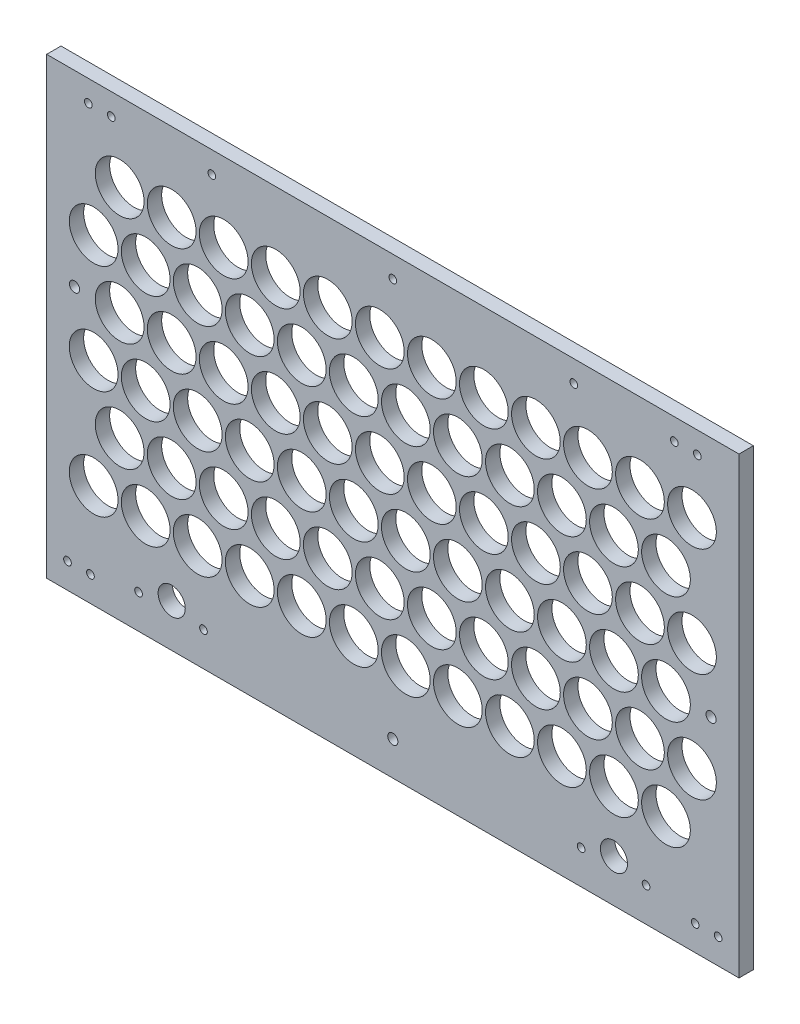
from build123d import *

# Parameters (mm, degrees)
SKETCH1_W                  = 306.05000007
SKETCH1_H                  = 197.4250001
BOSS_EXTRUDE1_DEPTH        = 6.35
CUT_EXTRUDE1_DEPTH         = 187.132543615
SKETCH4_R                  = 10.775
CUT_EXTRUDE2_DEPTH         = 187.132543615
LPATTERN1_COUNT            = 12
LPATTERN1_PITCH            = 23
LPATTERN2_COPY_1_DEPTH     = 187.132543615
LPATTERN2_COPY_2_DEPTH     = 187.132543615
LPATTERN2_COPY_3_DEPTH     = 187.132543615
LPATTERN2_COPY_4_DEPTH     = 187.132543615
LPATTERN2_COPY_5_DEPTH     = 187.132543615
LPATTERN2_COPY_6_DEPTH     = 187.132543615
LPATTERN2_COPY_7_DEPTH     = 187.132543615
LPATTERN2_COPY_8_DEPTH     = 187.132543615
LPATTERN2_COPY_9_DEPTH     = 187.132543615
LPATTERN2_COPY_10_DEPTH    = 187.132543615
LPATTERN2_COPY_11_DEPTH    = 187.132543615
LPATTERN2_COPY_12_DEPTH    = 187.132543615
LPATTERN2_COPY_13_DEPTH    = 187.132543615
LPATTERN2_COPY_14_DEPTH    = 187.132543615
LPATTERN2_COPY_15_DEPTH    = 187.132543615
LPATTERN2_COPY_16_DEPTH    = 187.132543615
LPATTERN2_COPY_17_DEPTH    = 187.132543615
LPATTERN2_COPY_18_DEPTH    = 187.132543615
LPATTERN2_COPY_19_DEPTH    = 187.132543615
LPATTERN2_COPY_20_DEPTH    = 187.132543615
LPATTERN2_COPY_21_DEPTH    = 187.132543615
LPATTERN2_COPY_22_DEPTH    = 187.132543615
LPATTERN2_COPY_23_SKETCH_R = 10.775
LPATTERN2_COPY_23_DEPTH    = 187.132543615
LPATTERN2_COPY_24_SKETCH_R = 10.775
LPATTERN2_COPY_24_DEPTH    = 187.132543615
LPATTERN2_COPY_25_SKETCH_R = 10.775
LPATTERN2_COPY_25_DEPTH    = 187.132543615
LPATTERN2_COPY_26_SKETCH_R = 10.775
LPATTERN2_COPY_26_DEPTH    = 187.132543615
LPATTERN2_COPY_27_SKETCH_R = 10.775
LPATTERN2_COPY_27_DEPTH    = 187.132543615
LPATTERN2_COPY_28_SKETCH_R = 10.775
LPATTERN2_COPY_28_DEPTH    = 187.132543615
LPATTERN2_COPY_29_SKETCH_R = 10.775
LPATTERN2_COPY_29_DEPTH    = 187.132543615
LPATTERN2_COPY_30_SKETCH_R = 10.775
LPATTERN2_COPY_30_DEPTH    = 187.132543615
LPATTERN2_COPY_31_SKETCH_R = 10.775
LPATTERN2_COPY_31_DEPTH    = 187.132543615
LPATTERN2_COPY_32_SKETCH_R = 10.775
LPATTERN2_COPY_32_DEPTH    = 187.132543615
LPATTERN2_COPY_33_SKETCH_R = 10.775
LPATTERN2_COPY_33_DEPTH    = 187.132543615
LPATTERN2_COPY_34_SKETCH_R = 10.775
LPATTERN2_COPY_34_DEPTH    = 187.132543615
LPATTERN2_COPY_35_SKETCH_R = 10.775
LPATTERN2_COPY_35_DEPTH    = 187.132543615
LPATTERN2_COPY_36_SKETCH_R = 10.775
LPATTERN2_COPY_36_DEPTH    = 187.132543615
LPATTERN2_COPY_37_SKETCH_R = 10.775
LPATTERN2_COPY_37_DEPTH    = 187.132543615
LPATTERN2_COPY_38_SKETCH_R = 10.775
LPATTERN2_COPY_38_DEPTH    = 187.132543615
LPATTERN2_COPY_39_SKETCH_R = 10.775
LPATTERN2_COPY_39_DEPTH    = 187.132543615
LPATTERN2_COPY_40_SKETCH_R = 10.775
LPATTERN2_COPY_40_DEPTH    = 187.132543615
LPATTERN2_COPY_41_SKETCH_R = 10.775
LPATTERN2_COPY_41_DEPTH    = 187.132543615
LPATTERN2_COPY_42_SKETCH_R = 10.775
LPATTERN2_COPY_42_DEPTH    = 187.132543615
LPATTERN2_COPY_43_SKETCH_R = 10.775
LPATTERN2_COPY_43_DEPTH    = 187.132543615
LPATTERN2_COPY_44_SKETCH_R = 10.775
LPATTERN2_COPY_44_DEPTH    = 187.132543615
LPATTERN2_COPY_45_DEPTH    = 187.132543615
LPATTERN2_COPY_46_DEPTH    = 187.132543615
LPATTERN2_COPY_47_SKETCH_R = 10.775
LPATTERN2_COPY_47_DEPTH    = 187.132543615
LPATTERN2_COPY_48_SKETCH_R = 10.775
LPATTERN2_COPY_48_DEPTH    = 187.132543615
SKETCH13_W                 = 306.05000007
SKETCH13_H                 = 6.35
BOSS_EXTRUDE2_DEPTH        = 3.175
SKETCH14_R                 = 6
CUT_EXTRUDE3_DEPTH         = 187.132543615
M3_CLEARANCE_HOLE1_D       = 3.4
SKETCH17_R                 = 2.25
CUT_EXTRUDE4_DEPTH         = 187.132543615


with BuildPart() as part:
    # Sketch1 → Boss-Extrude1 (new body)
    with BuildSketch(Plane.XY):
        with Locations((3.5e-08, -7.06250005)):
            Rectangle(SKETCH1_W, SKETCH1_H)
    extrude(amount=BOSS_EXTRUDE1_DEPTH)

    # Sketch3 → Cut-Extrude1 (cut, through all)
    with BuildSketch(Plane.XY.offset(6.35)):
        with BuildLine():
            ThreePointArc((-121.475, -60), (-132.24999993, -49.225), (-143.025, -59.999999859))
            ThreePointArc((-143.025, -59.999999859), (-139.869075617, -67.619075517), (-132.25, -70.775))
            ThreePointArc((-132.25, -70.775), (-124.630924433, -67.619075567), (-121.475, -60))
        make_face()
    cut_extrude1 = extrude(amount=-CUT_EXTRUDE1_DEPTH, mode=Mode.SUBTRACT)

    # Sketch4 → Cut-Extrude2 (cut, through all)
    with BuildSketch(Plane.XY.offset(6.35)):
        with Locations((-120.75, -36)):
            Circle(SKETCH4_R)
    cut_extrude2 = extrude(amount=-CUT_EXTRUDE2_DEPTH, mode=Mode.SUBTRACT)

    # LPattern1: Cut-Extrude1, Cut-Extrude2 ×12
    with Locations(*[(i * LPATTERN1_PITCH, 0, 0) for i in range(1, LPATTERN1_COUNT)]):
        add(cut_extrude1, mode=Mode.SUBTRACT)
        add(cut_extrude2, mode=Mode.SUBTRACT)

    # LPattern2 copy 1 sketch → LPattern2 copy 1 (cut, through all)
    with BuildSketch(Plane(origin=(23, 48, 6.35), x_dir=(1, 0, 0), z_dir=(0, 0, 1))):
        with BuildLine():
            ThreePointArc((-121.475, -60), (-132.24999993, -49.225), (-143.025, -59.999999859))
            ThreePointArc((-143.025, -59.999999859), (-139.869075617, -67.619075517), (-132.25, -70.775))
            ThreePointArc((-132.25, -70.775), (-124.630924433, -67.619075567), (-121.475, -60))
        make_face()
    extrude(amount=-LPATTERN2_COPY_1_DEPTH, mode=Mode.SUBTRACT)

    # LPattern2 copy 2 sketch → LPattern2 copy 2 (cut, through all)
    with BuildSketch(Plane(origin=(23, 96, 6.35), x_dir=(1, 0, 0), z_dir=(0, 0, 1))):
        with BuildLine():
            ThreePointArc((-121.475, -60), (-132.24999993, -49.225), (-143.025, -59.999999859))
            ThreePointArc((-143.025, -59.999999859), (-139.869075617, -67.619075517), (-132.25, -70.775))
            ThreePointArc((-132.25, -70.775), (-124.630924433, -67.619075567), (-121.475, -60))
        make_face()
    extrude(amount=-LPATTERN2_COPY_2_DEPTH, mode=Mode.SUBTRACT)

    # LPattern2 copy 3 sketch → LPattern2 copy 3 (cut, through all)
    with BuildSketch(Plane(origin=(46, 48, 6.35), x_dir=(1, 0, 0), z_dir=(0, 0, 1))):
        with BuildLine():
            ThreePointArc((-121.475, -60), (-132.24999993, -49.225), (-143.025, -59.999999859))
            ThreePointArc((-143.025, -59.999999859), (-139.869075617, -67.619075517), (-132.25, -70.775))
            ThreePointArc((-132.25, -70.775), (-124.630924433, -67.619075567), (-121.475, -60))
        make_face()
    extrude(amount=-LPATTERN2_COPY_3_DEPTH, mode=Mode.SUBTRACT)

    # LPattern2 copy 4 sketch → LPattern2 copy 4 (cut, through all)
    with BuildSketch(Plane(origin=(46, 96, 6.35), x_dir=(1, 0, 0), z_dir=(0, 0, 1))):
        with BuildLine():
            ThreePointArc((-121.475, -60), (-132.24999993, -49.225), (-143.025, -59.999999859))
            ThreePointArc((-143.025, -59.999999859), (-139.869075617, -67.619075517), (-132.25, -70.775))
            ThreePointArc((-132.25, -70.775), (-124.630924433, -67.619075567), (-121.475, -60))
        make_face()
    extrude(amount=-LPATTERN2_COPY_4_DEPTH, mode=Mode.SUBTRACT)

    # LPattern2 copy 5 sketch → LPattern2 copy 5 (cut, through all)
    with BuildSketch(Plane(origin=(69, 48, 6.35), x_dir=(1, 0, 0), z_dir=(0, 0, 1))):
        with BuildLine():
            ThreePointArc((-121.475, -60), (-132.24999993, -49.225), (-143.025, -59.999999859))
            ThreePointArc((-143.025, -59.999999859), (-139.869075617, -67.619075517), (-132.25, -70.775))
            ThreePointArc((-132.25, -70.775), (-124.630924433, -67.619075567), (-121.475, -60))
        make_face()
    extrude(amount=-LPATTERN2_COPY_5_DEPTH, mode=Mode.SUBTRACT)

    # LPattern2 copy 6 sketch → LPattern2 copy 6 (cut, through all)
    with BuildSketch(Plane(origin=(69, 96, 6.35), x_dir=(1, 0, 0), z_dir=(0, 0, 1))):
        with BuildLine():
            ThreePointArc((-121.475, -60), (-132.24999993, -49.225), (-143.025, -59.999999859))
            ThreePointArc((-143.025, -59.999999859), (-139.869075617, -67.619075517), (-132.25, -70.775))
            ThreePointArc((-132.25, -70.775), (-124.630924433, -67.619075567), (-121.475, -60))
        make_face()
    extrude(amount=-LPATTERN2_COPY_6_DEPTH, mode=Mode.SUBTRACT)

    # LPattern2 copy 7 sketch → LPattern2 copy 7 (cut, through all)
    with BuildSketch(Plane(origin=(92, 48, 6.35), x_dir=(1, 0, 0), z_dir=(0, 0, 1))):
        with BuildLine():
            ThreePointArc((-121.475, -60), (-132.24999993, -49.225), (-143.025, -59.999999859))
            ThreePointArc((-143.025, -59.999999859), (-139.869075617, -67.619075517), (-132.25, -70.775))
            ThreePointArc((-132.25, -70.775), (-124.630924433, -67.619075567), (-121.475, -60))
        make_face()
    extrude(amount=-LPATTERN2_COPY_7_DEPTH, mode=Mode.SUBTRACT)

    # LPattern2 copy 8 sketch → LPattern2 copy 8 (cut, through all)
    with BuildSketch(Plane(origin=(92, 96, 6.35), x_dir=(1, 0, 0), z_dir=(0, 0, 1))):
        with BuildLine():
            ThreePointArc((-121.475, -60), (-132.24999993, -49.225), (-143.025, -59.999999859))
            ThreePointArc((-143.025, -59.999999859), (-139.869075617, -67.619075517), (-132.25, -70.775))
            ThreePointArc((-132.25, -70.775), (-124.630924433, -67.619075567), (-121.475, -60))
        make_face()
    extrude(amount=-LPATTERN2_COPY_8_DEPTH, mode=Mode.SUBTRACT)

    # LPattern2 copy 9 sketch → LPattern2 copy 9 (cut, through all)
    with BuildSketch(Plane(origin=(115, 48, 6.35), x_dir=(1, 0, 0), z_dir=(0, 0, 1))):
        with BuildLine():
            ThreePointArc((-121.475, -60), (-132.24999993, -49.225), (-143.025, -59.999999859))
            ThreePointArc((-143.025, -59.999999859), (-139.869075617, -67.619075517), (-132.25, -70.775))
            ThreePointArc((-132.25, -70.775), (-124.630924433, -67.619075567), (-121.475, -60))
        make_face()
    extrude(amount=-LPATTERN2_COPY_9_DEPTH, mode=Mode.SUBTRACT)

    # LPattern2 copy 10 sketch → LPattern2 copy 10 (cut, through all)
    with BuildSketch(Plane(origin=(115, 96, 6.35), x_dir=(1, 0, 0), z_dir=(0, 0, 1))):
        with BuildLine():
            ThreePointArc((-121.475, -60), (-132.24999993, -49.225), (-143.025, -59.999999859))
            ThreePointArc((-143.025, -59.999999859), (-139.869075617, -67.619075517), (-132.25, -70.775))
            ThreePointArc((-132.25, -70.775), (-124.630924433, -67.619075567), (-121.475, -60))
        make_face()
    extrude(amount=-LPATTERN2_COPY_10_DEPTH, mode=Mode.SUBTRACT)

    # LPattern2 copy 11 sketch → LPattern2 copy 11 (cut, through all)
    with BuildSketch(Plane(origin=(138, 48, 6.35), x_dir=(1, 0, 0), z_dir=(0, 0, 1))):
        with BuildLine():
            ThreePointArc((-121.475, -60), (-132.24999993, -49.225), (-143.025, -59.999999859))
            ThreePointArc((-143.025, -59.999999859), (-139.869075617, -67.619075517), (-132.25, -70.775))
            ThreePointArc((-132.25, -70.775), (-124.630924433, -67.619075567), (-121.475, -60))
        make_face()
    extrude(amount=-LPATTERN2_COPY_11_DEPTH, mode=Mode.SUBTRACT)

    # LPattern2 copy 12 sketch → LPattern2 copy 12 (cut, through all)
    with BuildSketch(Plane(origin=(138, 96, 6.35), x_dir=(1, 0, 0), z_dir=(0, 0, 1))):
        with BuildLine():
            ThreePointArc((-121.475, -60), (-132.24999993, -49.225), (-143.025, -59.999999859))
            ThreePointArc((-143.025, -59.999999859), (-139.869075617, -67.619075517), (-132.25, -70.775))
            ThreePointArc((-132.25, -70.775), (-124.630924433, -67.619075567), (-121.475, -60))
        make_face()
    extrude(amount=-LPATTERN2_COPY_12_DEPTH, mode=Mode.SUBTRACT)

    # LPattern2 copy 13 sketch → LPattern2 copy 13 (cut, through all)
    with BuildSketch(Plane(origin=(161, 48, 6.35), x_dir=(1, 0, 0), z_dir=(0, 0, 1))):
        with BuildLine():
            ThreePointArc((-121.475, -60), (-132.24999993, -49.225), (-143.025, -59.999999859))
            ThreePointArc((-143.025, -59.999999859), (-139.869075617, -67.619075517), (-132.25, -70.775))
            ThreePointArc((-132.25, -70.775), (-124.630924433, -67.619075567), (-121.475, -60))
        make_face()
    extrude(amount=-LPATTERN2_COPY_13_DEPTH, mode=Mode.SUBTRACT)

    # LPattern2 copy 14 sketch → LPattern2 copy 14 (cut, through all)
    with BuildSketch(Plane(origin=(161, 96, 6.35), x_dir=(1, 0, 0), z_dir=(0, 0, 1))):
        with BuildLine():
            ThreePointArc((-121.475, -60), (-132.24999993, -49.225), (-143.025, -59.999999859))
            ThreePointArc((-143.025, -59.999999859), (-139.869075617, -67.619075517), (-132.25, -70.775))
            ThreePointArc((-132.25, -70.775), (-124.630924433, -67.619075567), (-121.475, -60))
        make_face()
    extrude(amount=-LPATTERN2_COPY_14_DEPTH, mode=Mode.SUBTRACT)

    # LPattern2 copy 15 sketch → LPattern2 copy 15 (cut, through all)
    with BuildSketch(Plane(origin=(184, 48, 6.35), x_dir=(1, 0, 0), z_dir=(0, 0, 1))):
        with BuildLine():
            ThreePointArc((-121.475, -60), (-132.24999993, -49.225), (-143.025, -59.999999859))
            ThreePointArc((-143.025, -59.999999859), (-139.869075617, -67.619075517), (-132.25, -70.775))
            ThreePointArc((-132.25, -70.775), (-124.630924433, -67.619075567), (-121.475, -60))
        make_face()
    extrude(amount=-LPATTERN2_COPY_15_DEPTH, mode=Mode.SUBTRACT)

    # LPattern2 copy 16 sketch → LPattern2 copy 16 (cut, through all)
    with BuildSketch(Plane(origin=(184, 96, 6.35), x_dir=(1, 0, 0), z_dir=(0, 0, 1))):
        with BuildLine():
            ThreePointArc((-121.475, -60), (-132.24999993, -49.225), (-143.025, -59.999999859))
            ThreePointArc((-143.025, -59.999999859), (-139.869075617, -67.619075517), (-132.25, -70.775))
            ThreePointArc((-132.25, -70.775), (-124.630924433, -67.619075567), (-121.475, -60))
        make_face()
    extrude(amount=-LPATTERN2_COPY_16_DEPTH, mode=Mode.SUBTRACT)

    # LPattern2 copy 17 sketch → LPattern2 copy 17 (cut, through all)
    with BuildSketch(Plane(origin=(207, 48, 6.35), x_dir=(1, 0, 0), z_dir=(0, 0, 1))):
        with BuildLine():
            ThreePointArc((-121.475, -60), (-132.24999993, -49.225), (-143.025, -59.999999859))
            ThreePointArc((-143.025, -59.999999859), (-139.869075617, -67.619075517), (-132.25, -70.775))
            ThreePointArc((-132.25, -70.775), (-124.630924433, -67.619075567), (-121.475, -60))
        make_face()
    extrude(amount=-LPATTERN2_COPY_17_DEPTH, mode=Mode.SUBTRACT)

    # LPattern2 copy 18 sketch → LPattern2 copy 18 (cut, through all)
    with BuildSketch(Plane(origin=(207, 96, 6.35), x_dir=(1, 0, 0), z_dir=(0, 0, 1))):
        with BuildLine():
            ThreePointArc((-121.475, -60), (-132.24999993, -49.225), (-143.025, -59.999999859))
            ThreePointArc((-143.025, -59.999999859), (-139.869075617, -67.619075517), (-132.25, -70.775))
            ThreePointArc((-132.25, -70.775), (-124.630924433, -67.619075567), (-121.475, -60))
        make_face()
    extrude(amount=-LPATTERN2_COPY_18_DEPTH, mode=Mode.SUBTRACT)

    # LPattern2 copy 19 sketch → LPattern2 copy 19 (cut, through all)
    with BuildSketch(Plane(origin=(230, 48, 6.35), x_dir=(1, 0, 0), z_dir=(0, 0, 1))):
        with BuildLine():
            ThreePointArc((-121.475, -60), (-132.24999993, -49.225), (-143.025, -59.999999859))
            ThreePointArc((-143.025, -59.999999859), (-139.869075617, -67.619075517), (-132.25, -70.775))
            ThreePointArc((-132.25, -70.775), (-124.630924433, -67.619075567), (-121.475, -60))
        make_face()
    extrude(amount=-LPATTERN2_COPY_19_DEPTH, mode=Mode.SUBTRACT)

    # LPattern2 copy 20 sketch → LPattern2 copy 20 (cut, through all)
    with BuildSketch(Plane(origin=(230, 96, 6.35), x_dir=(1, 0, 0), z_dir=(0, 0, 1))):
        with BuildLine():
            ThreePointArc((-121.475, -60), (-132.24999993, -49.225), (-143.025, -59.999999859))
            ThreePointArc((-143.025, -59.999999859), (-139.869075617, -67.619075517), (-132.25, -70.775))
            ThreePointArc((-132.25, -70.775), (-124.630924433, -67.619075567), (-121.475, -60))
        make_face()
    extrude(amount=-LPATTERN2_COPY_20_DEPTH, mode=Mode.SUBTRACT)

    # LPattern2 copy 21 sketch → LPattern2 copy 21 (cut, through all)
    with BuildSketch(Plane(origin=(253, 48, 6.35), x_dir=(1, 0, 0), z_dir=(0, 0, 1))):
        with BuildLine():
            ThreePointArc((-121.475, -60), (-132.24999993, -49.225), (-143.025, -59.999999859))
            ThreePointArc((-143.025, -59.999999859), (-139.869075617, -67.619075517), (-132.25, -70.775))
            ThreePointArc((-132.25, -70.775), (-124.630924433, -67.619075567), (-121.475, -60))
        make_face()
    extrude(amount=-LPATTERN2_COPY_21_DEPTH, mode=Mode.SUBTRACT)

    # LPattern2 copy 22 sketch → LPattern2 copy 22 (cut, through all)
    with BuildSketch(Plane(origin=(253, 96, 6.35), x_dir=(1, 0, 0), z_dir=(0, 0, 1))):
        with BuildLine():
            ThreePointArc((-121.475, -60), (-132.24999993, -49.225), (-143.025, -59.999999859))
            ThreePointArc((-143.025, -59.999999859), (-139.869075617, -67.619075517), (-132.25, -70.775))
            ThreePointArc((-132.25, -70.775), (-124.630924433, -67.619075567), (-121.475, -60))
        make_face()
    extrude(amount=-LPATTERN2_COPY_22_DEPTH, mode=Mode.SUBTRACT)

    # LPattern2 copy 23 sketch → LPattern2 copy 23 (cut, through all)
    with BuildSketch(Plane(origin=(23, 48, 6.35), x_dir=(1, 0, 0), z_dir=(0, 0, 1))):
        with Locations((-120.75, -36)):
            Circle(LPATTERN2_COPY_23_SKETCH_R)
    extrude(amount=-LPATTERN2_COPY_23_DEPTH, mode=Mode.SUBTRACT)

    # LPattern2 copy 24 sketch → LPattern2 copy 24 (cut, through all)
    with BuildSketch(Plane(origin=(23, 96, 6.35), x_dir=(1, 0, 0), z_dir=(0, 0, 1))):
        with Locations((-120.75, -36)):
            Circle(LPATTERN2_COPY_24_SKETCH_R)
    extrude(amount=-LPATTERN2_COPY_24_DEPTH, mode=Mode.SUBTRACT)

    # LPattern2 copy 25 sketch → LPattern2 copy 25 (cut, through all)
    with BuildSketch(Plane(origin=(46, 48, 6.35), x_dir=(1, 0, 0), z_dir=(0, 0, 1))):
        with Locations((-120.75, -36)):
            Circle(LPATTERN2_COPY_25_SKETCH_R)
    extrude(amount=-LPATTERN2_COPY_25_DEPTH, mode=Mode.SUBTRACT)

    # LPattern2 copy 26 sketch → LPattern2 copy 26 (cut, through all)
    with BuildSketch(Plane(origin=(46, 96, 6.35), x_dir=(1, 0, 0), z_dir=(0, 0, 1))):
        with Locations((-120.75, -36)):
            Circle(LPATTERN2_COPY_26_SKETCH_R)
    extrude(amount=-LPATTERN2_COPY_26_DEPTH, mode=Mode.SUBTRACT)

    # LPattern2 copy 27 sketch → LPattern2 copy 27 (cut, through all)
    with BuildSketch(Plane(origin=(69, 48, 6.35), x_dir=(1, 0, 0), z_dir=(0, 0, 1))):
        with Locations((-120.75, -36)):
            Circle(LPATTERN2_COPY_27_SKETCH_R)
    extrude(amount=-LPATTERN2_COPY_27_DEPTH, mode=Mode.SUBTRACT)

    # LPattern2 copy 28 sketch → LPattern2 copy 28 (cut, through all)
    with BuildSketch(Plane(origin=(69, 96, 6.35), x_dir=(1, 0, 0), z_dir=(0, 0, 1))):
        with Locations((-120.75, -36)):
            Circle(LPATTERN2_COPY_28_SKETCH_R)
    extrude(amount=-LPATTERN2_COPY_28_DEPTH, mode=Mode.SUBTRACT)

    # LPattern2 copy 29 sketch → LPattern2 copy 29 (cut, through all)
    with BuildSketch(Plane(origin=(92, 48, 6.35), x_dir=(1, 0, 0), z_dir=(0, 0, 1))):
        with Locations((-120.75, -36)):
            Circle(LPATTERN2_COPY_29_SKETCH_R)
    extrude(amount=-LPATTERN2_COPY_29_DEPTH, mode=Mode.SUBTRACT)

    # LPattern2 copy 30 sketch → LPattern2 copy 30 (cut, through all)
    with BuildSketch(Plane(origin=(92, 96, 6.35), x_dir=(1, 0, 0), z_dir=(0, 0, 1))):
        with Locations((-120.75, -36)):
            Circle(LPATTERN2_COPY_30_SKETCH_R)
    extrude(amount=-LPATTERN2_COPY_30_DEPTH, mode=Mode.SUBTRACT)

    # LPattern2 copy 31 sketch → LPattern2 copy 31 (cut, through all)
    with BuildSketch(Plane(origin=(115, 48, 6.35), x_dir=(1, 0, 0), z_dir=(0, 0, 1))):
        with Locations((-120.75, -36)):
            Circle(LPATTERN2_COPY_31_SKETCH_R)
    extrude(amount=-LPATTERN2_COPY_31_DEPTH, mode=Mode.SUBTRACT)

    # LPattern2 copy 32 sketch → LPattern2 copy 32 (cut, through all)
    with BuildSketch(Plane(origin=(115, 96, 6.35), x_dir=(1, 0, 0), z_dir=(0, 0, 1))):
        with Locations((-120.75, -36)):
            Circle(LPATTERN2_COPY_32_SKETCH_R)
    extrude(amount=-LPATTERN2_COPY_32_DEPTH, mode=Mode.SUBTRACT)

    # LPattern2 copy 33 sketch → LPattern2 copy 33 (cut, through all)
    with BuildSketch(Plane(origin=(138, 48, 6.35), x_dir=(1, 0, 0), z_dir=(0, 0, 1))):
        with Locations((-120.75, -36)):
            Circle(LPATTERN2_COPY_33_SKETCH_R)
    extrude(amount=-LPATTERN2_COPY_33_DEPTH, mode=Mode.SUBTRACT)

    # LPattern2 copy 34 sketch → LPattern2 copy 34 (cut, through all)
    with BuildSketch(Plane(origin=(138, 96, 6.35), x_dir=(1, 0, 0), z_dir=(0, 0, 1))):
        with Locations((-120.75, -36)):
            Circle(LPATTERN2_COPY_34_SKETCH_R)
    extrude(amount=-LPATTERN2_COPY_34_DEPTH, mode=Mode.SUBTRACT)

    # LPattern2 copy 35 sketch → LPattern2 copy 35 (cut, through all)
    with BuildSketch(Plane(origin=(161, 48, 6.35), x_dir=(1, 0, 0), z_dir=(0, 0, 1))):
        with Locations((-120.75, -36)):
            Circle(LPATTERN2_COPY_35_SKETCH_R)
    extrude(amount=-LPATTERN2_COPY_35_DEPTH, mode=Mode.SUBTRACT)

    # LPattern2 copy 36 sketch → LPattern2 copy 36 (cut, through all)
    with BuildSketch(Plane(origin=(161, 96, 6.35), x_dir=(1, 0, 0), z_dir=(0, 0, 1))):
        with Locations((-120.75, -36)):
            Circle(LPATTERN2_COPY_36_SKETCH_R)
    extrude(amount=-LPATTERN2_COPY_36_DEPTH, mode=Mode.SUBTRACT)

    # LPattern2 copy 37 sketch → LPattern2 copy 37 (cut, through all)
    with BuildSketch(Plane(origin=(184, 48, 6.35), x_dir=(1, 0, 0), z_dir=(0, 0, 1))):
        with Locations((-120.75, -36)):
            Circle(LPATTERN2_COPY_37_SKETCH_R)
    extrude(amount=-LPATTERN2_COPY_37_DEPTH, mode=Mode.SUBTRACT)

    # LPattern2 copy 38 sketch → LPattern2 copy 38 (cut, through all)
    with BuildSketch(Plane(origin=(184, 96, 6.35), x_dir=(1, 0, 0), z_dir=(0, 0, 1))):
        with Locations((-120.75, -36)):
            Circle(LPATTERN2_COPY_38_SKETCH_R)
    extrude(amount=-LPATTERN2_COPY_38_DEPTH, mode=Mode.SUBTRACT)

    # LPattern2 copy 39 sketch → LPattern2 copy 39 (cut, through all)
    with BuildSketch(Plane(origin=(207, 48, 6.35), x_dir=(1, 0, 0), z_dir=(0, 0, 1))):
        with Locations((-120.75, -36)):
            Circle(LPATTERN2_COPY_39_SKETCH_R)
    extrude(amount=-LPATTERN2_COPY_39_DEPTH, mode=Mode.SUBTRACT)

    # LPattern2 copy 40 sketch → LPattern2 copy 40 (cut, through all)
    with BuildSketch(Plane(origin=(207, 96, 6.35), x_dir=(1, 0, 0), z_dir=(0, 0, 1))):
        with Locations((-120.75, -36)):
            Circle(LPATTERN2_COPY_40_SKETCH_R)
    extrude(amount=-LPATTERN2_COPY_40_DEPTH, mode=Mode.SUBTRACT)

    # LPattern2 copy 41 sketch → LPattern2 copy 41 (cut, through all)
    with BuildSketch(Plane(origin=(230, 48, 6.35), x_dir=(1, 0, 0), z_dir=(0, 0, 1))):
        with Locations((-120.75, -36)):
            Circle(LPATTERN2_COPY_41_SKETCH_R)
    extrude(amount=-LPATTERN2_COPY_41_DEPTH, mode=Mode.SUBTRACT)

    # LPattern2 copy 42 sketch → LPattern2 copy 42 (cut, through all)
    with BuildSketch(Plane(origin=(230, 96, 6.35), x_dir=(1, 0, 0), z_dir=(0, 0, 1))):
        with Locations((-120.75, -36)):
            Circle(LPATTERN2_COPY_42_SKETCH_R)
    extrude(amount=-LPATTERN2_COPY_42_DEPTH, mode=Mode.SUBTRACT)

    # LPattern2 copy 43 sketch → LPattern2 copy 43 (cut, through all)
    with BuildSketch(Plane(origin=(253, 48, 6.35), x_dir=(1, 0, 0), z_dir=(0, 0, 1))):
        with Locations((-120.75, -36)):
            Circle(LPATTERN2_COPY_43_SKETCH_R)
    extrude(amount=-LPATTERN2_COPY_43_DEPTH, mode=Mode.SUBTRACT)

    # LPattern2 copy 44 sketch → LPattern2 copy 44 (cut, through all)
    with BuildSketch(Plane(origin=(253, 96, 6.35), x_dir=(1, 0, 0), z_dir=(0, 0, 1))):
        with Locations((-120.75, -36)):
            Circle(LPATTERN2_COPY_44_SKETCH_R)
    extrude(amount=-LPATTERN2_COPY_44_DEPTH, mode=Mode.SUBTRACT)

    # LPattern2 copy 45 sketch → LPattern2 copy 45 (cut, through all)
    with BuildSketch(Plane(origin=(0, 48, 6.35), x_dir=(1, 0, 0), z_dir=(0, 0, 1))):
        with BuildLine():
            ThreePointArc((-121.475, -60), (-132.24999993, -49.225), (-143.025, -59.999999859))
            ThreePointArc((-143.025, -59.999999859), (-139.869075617, -67.619075517), (-132.25, -70.775))
            ThreePointArc((-132.25, -70.775), (-124.630924433, -67.619075567), (-121.475, -60))
        make_face()
    extrude(amount=-LPATTERN2_COPY_45_DEPTH, mode=Mode.SUBTRACT)

    # LPattern2 copy 46 sketch → LPattern2 copy 46 (cut, through all)
    with BuildSketch(Plane(origin=(0, 96, 6.35), x_dir=(1, 0, 0), z_dir=(0, 0, 1))):
        with BuildLine():
            ThreePointArc((-121.475, -60), (-132.24999993, -49.225), (-143.025, -59.999999859))
            ThreePointArc((-143.025, -59.999999859), (-139.869075617, -67.619075517), (-132.25, -70.775))
            ThreePointArc((-132.25, -70.775), (-124.630924433, -67.619075567), (-121.475, -60))
        make_face()
    extrude(amount=-LPATTERN2_COPY_46_DEPTH, mode=Mode.SUBTRACT)

    # LPattern2 copy 47 sketch → LPattern2 copy 47 (cut, through all)
    with BuildSketch(Plane(origin=(0, 48, 6.35), x_dir=(1, 0, 0), z_dir=(0, 0, 1))):
        with Locations((-120.75, -36)):
            Circle(LPATTERN2_COPY_47_SKETCH_R)
    extrude(amount=-LPATTERN2_COPY_47_DEPTH, mode=Mode.SUBTRACT)

    # LPattern2 copy 48 sketch → LPattern2 copy 48 (cut, through all)
    with BuildSketch(Plane(origin=(0, 96, 6.35), x_dir=(1, 0, 0), z_dir=(0, 0, 1))):
        with Locations((-120.75, -36)):
            Circle(LPATTERN2_COPY_48_SKETCH_R)
    extrude(amount=-LPATTERN2_COPY_48_DEPTH, mode=Mode.SUBTRACT)

    # Sketch13 → Boss-Extrude2 (add)
    with BuildSketch(Plane(origin=(0, 91.65, 0), x_dir=(1, 0, 0), z_dir=(0, 1, 0))):
        with Locations((3.5e-08, -3.175)):
            Rectangle(SKETCH13_W, SKETCH13_H)
    extrude(amount=BOSS_EXTRUDE2_DEPTH)

    # Sketch14 → Cut-Extrude3 (cut, through all)
    with BuildSketch(Plane(origin=(0, 0, 0), x_dir=(-1, 0, 0), z_dir=(0, 0, -1))):
        with Locations((-97.75, -86.7750001)):
            Circle(SKETCH14_R)
    cut_extrude3 = extrude(amount=-CUT_EXTRUDE3_DEPTH, mode=Mode.SUBTRACT)

    # Mirror1: Cut-Extrude3 across plane
    add(cut_extrude3.mirror(Plane(origin=(0, 0, 0), x_dir=(0, 0, 1), z_dir=(1, 0, 0))), mode=Mode.SUBTRACT)

    # M3 Clearance Hole1 (through all)
    with Locations(Plane(origin=(0, 0, 0), x_dir=(-1, 0, 0), z_dir=(0, 0, -1))):
        with Locations((-111.94, -90.775), (-83.25, -90.775), (83.712, -90.775), (134.610000066, 85.3), (124.450000066, 85.3), (80, 85.3), (0, 85.3), (-80, 85.3), (-124.450000066, 85.3), (-134.610000066, 85.3), (143.817500066, -94.6000001), (133.657500066, -94.6000001), (-133.657500066, -94.6000001), (-143.817500066, -94.6000001), (112.402, -90.775)):
            Hole(M3_CLEARANCE_HOLE1_D / 2)

    # Sketch17 → Cut-Extrude4 (cut, through all)
    with BuildSketch(Plane(origin=(0, 0, 0), x_dir=(-1, 0, 0), z_dir=(0, 0, -1))):
        with Locations((0, -90.775)):
            Circle(SKETCH17_R)
        with Locations((140.687500033, 12)):
            Circle(SKETCH17_R)
        with Locations((-140.687500033, -12)):
            Circle(SKETCH17_R)
    extrude(amount=-CUT_EXTRUDE4_DEPTH, mode=Mode.SUBTRACT)


solid = part.part
